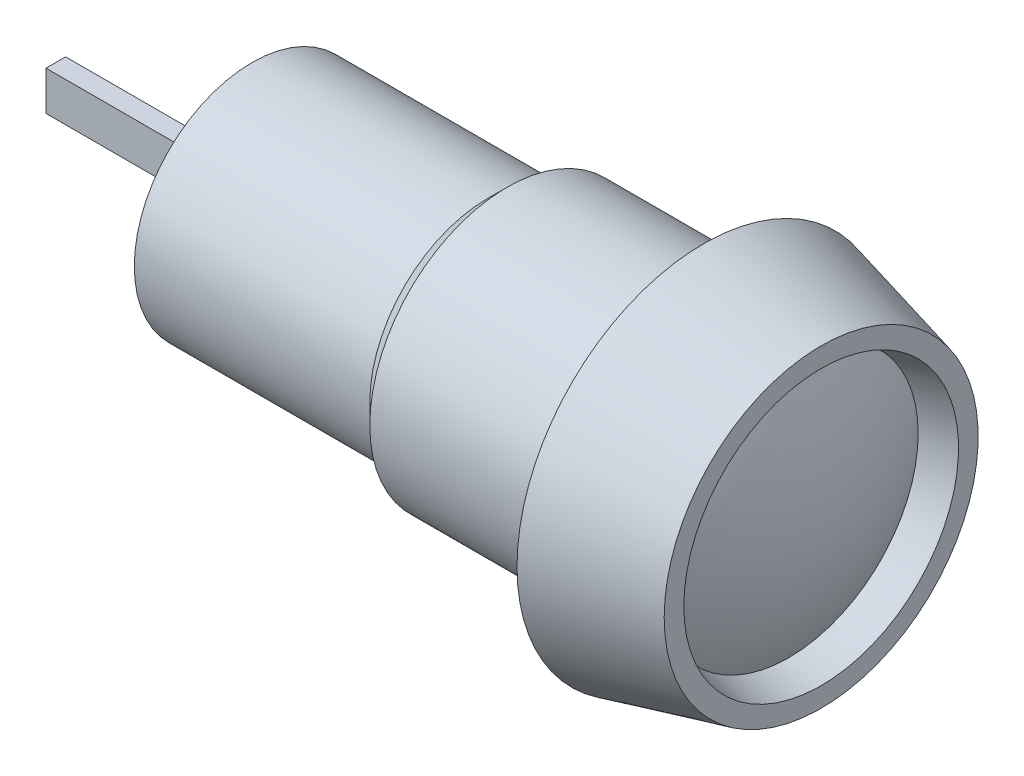
from build123d import *

# Parameters (mm, degrees)
SKETCH3_W           = 10
SKETCH3_H           = 2
BOSS_EXTRUDE1_DEPTH = 0.5


with BuildPart() as part:
    # Sketch1 → Revolve1 (revolve)
    with BuildSketch(Plane(origin=(0, 0, 0), x_dir=(1, 0, 0), z_dir=(0, 1, 0))):
        with BuildLine():
            Line((6, 7), (6, 8))
            Line((6, 8), (0, 9.5))
            Line((0, 9.5), (0, 7))
            Line((0, 7), (-10, 7))
            Line((-10, 7), (-11, 6))
            Line((-11, 6), (-23, 6))
            Line((-23, 6), (-23, 0))
            Line((-23, 0), (6, 0))
            ThreePointArc((6, 0), (5.581995002, 3.395498751), (4.352941176, 6.588235294))
            Line((4.352941176, 6.588235294), (6, 7))
        make_face()
    revolve(axis=Axis((-23, 0, 0), (1, 0, 0)))

    # Sketch3 → Boss-Extrude1 (add, symmetric)
    with BuildSketch(Plane.XY):
        with Locations((-28, 0)):
            Rectangle(SKETCH3_W, SKETCH3_H)
    extrude(amount=BOSS_EXTRUDE1_DEPTH, both=True)


solid = part.part
